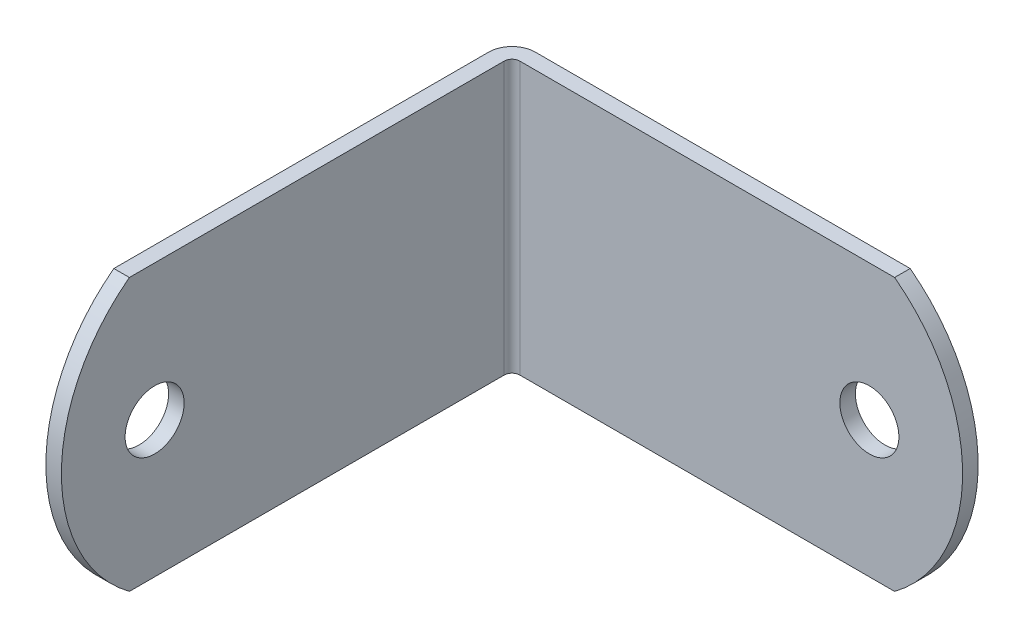
from build123d import *

# Parameters (mm, degrees)
EXTRUDE_THIN1_START     = -11.1125
EXTRUDE_THIN1_DEPTH     = 22.225
SKETCH4_R               = 2.413
EXTRUDE3_DEPTH          = 55.143758239
SKETCH6_R               = 2.413
CUT_EXTRUDE1_DEPTH      = 56.015521957
CUT_EXTRUDE2_DEPTH      = 55.143758239
CUT_EXTRUDE2_DEPTH_BACK = 55.143758239
CUT_EXTRUDE3_DEPTH      = 56.015521957
CUT_EXTRUDE3_DEPTH_BACK = 56.015521957


# Read off the part's stored shape, not the designer's step: Extrude-Thin1
with BuildPart() as part:
    # Extrude-Thin1 outline → Extrude-Thin1 (new body)
    with BuildSketch(Plane(origin=(0, 0, 0), x_dir=(1, 0, 0), z_dir=(0, 1, 0)).offset(EXTRUDE_THIN1_START)):
        with BuildLine():
            Line((1.905, -1.27), (38.1, -1.27))
            Line((38.1, -1.27), (38.1, 0))
            Line((38.1, 0), (1.905, 0))
            ThreePointArc((1.905, 0), (0.557961582, -0.557961582), (0, -1.905))
            Line((0, -1.905), (0, -38.1))
            Line((0, -38.1), (1.27, -38.1))
            Line((1.27, -38.1), (1.27, -1.905))
            ThreePointArc((1.27, -1.905), (1.455987194, -1.455987194), (1.905, -1.27))
        make_face()
    extrude(amount=EXTRUDE_THIN1_DEPTH)

    # Sketch4 → Extrude3 (cut, through all)
    with BuildSketch(Plane(origin=(1.27, 0, 0), x_dir=(0, 0, -1), z_dir=(1, 0, 0))):
        with Locations((-30.48, 0)):
            Circle(SKETCH4_R)
    extrude(amount=-EXTRUDE3_DEPTH, mode=Mode.SUBTRACT)

    # Sketch6 → Cut-Extrude1 (cut, through all)
    with BuildSketch(Plane.XY):
        with Locations(Location((30.48, 0, 0), (0, 0, 180))):
            Circle(SKETCH6_R)
    extrude(amount=CUT_EXTRUDE1_DEPTH, mode=Mode.SUBTRACT)

    # Sketch8 → Cut-Extrude2 (cut, two sides: drawn at the far end of the back side and taken through both)
    with BuildSketch(Plane(origin=(1.27, 0, 0), x_dir=(0, 0, -1), z_dir=(1, 0, 0)).offset(-CUT_EXTRUDE2_DEPTH_BACK)):
        with BuildLine():
            Line((38.510183264, 64.402949948), (-32.54375, 11.1125))
            ThreePointArc((-32.54375, 11.1125), (-38.1, 0), (-32.54375, -11.1125))
            Line((-32.54375, -11.1125), (38.510183264, -64.402949948))
            Line((38.510183264, -64.402949948), (-139.124649895, -64.402949948))
            Line((-139.124649895, -64.402949948), (-139.124649895, 64.402949948))
            Line((-139.124649895, 64.402949948), (38.510183264, 64.402949948))
        make_face()
    extrude(amount=CUT_EXTRUDE2_DEPTH + CUT_EXTRUDE2_DEPTH_BACK, mode=Mode.SUBTRACT)

    # Sketch9 → Cut-Extrude3 (cut, two sides: drawn at the far end of the back side and taken through both)
    with BuildSketch(Plane.XY.offset(-CUT_EXTRUDE3_DEPTH_BACK)):
        with BuildLine():
            Line((-38.510183264, 64.402949948), (32.54375, 11.1125))
            ThreePointArc((32.54375, 11.1125), (38.1, 0), (32.54375, -11.1125))
            Line((32.54375, -11.1125), (-38.510183264, -64.402949948))
            Line((-38.510183264, -64.402949948), (139.124649895, -64.402949948))
            Line((139.124649895, -64.402949948), (139.124649895, 64.402949948))
            Line((139.124649895, 64.402949948), (-38.510183264, 64.402949948))
        make_face()
    extrude(amount=CUT_EXTRUDE3_DEPTH + CUT_EXTRUDE3_DEPTH_BACK, mode=Mode.SUBTRACT)


solid = part.part
